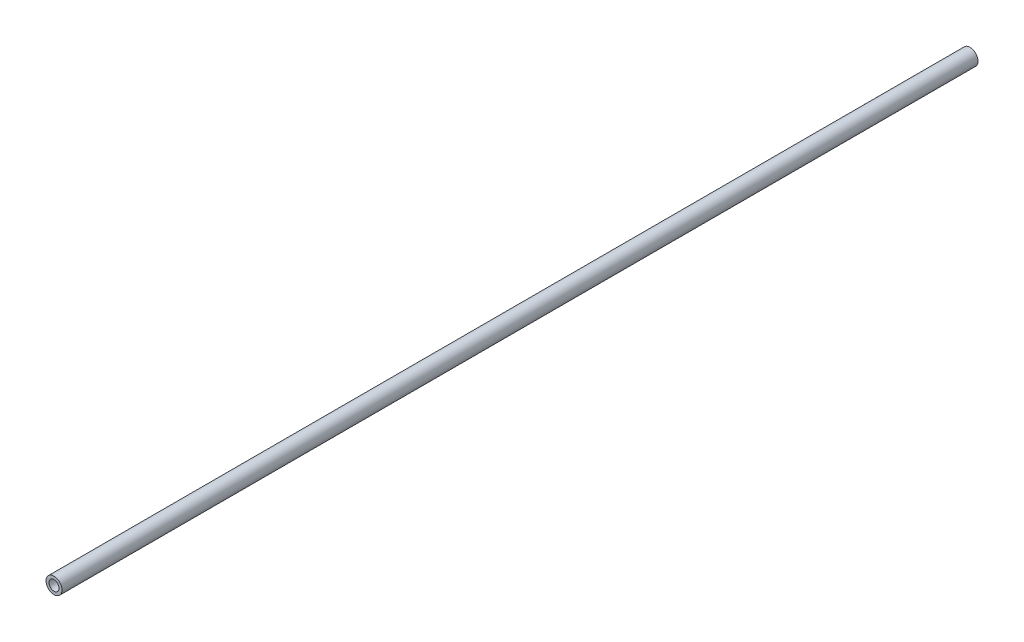
from build123d import *

# Parameters (mm, degrees)
SKETCH1_R           = 2.3876
SKETCH1_R_2         = 1.4986
BOSS_EXTRUDE1_DEPTH = 273.05


with BuildPart() as part:
    # Sketch1 → Boss-Extrude1 (new body)
    with BuildSketch(Plane.XY):
        Circle(SKETCH1_R)
        Circle(SKETCH1_R_2, mode=Mode.SUBTRACT)
    extrude(amount=BOSS_EXTRUDE1_DEPTH)


solid = part.part
